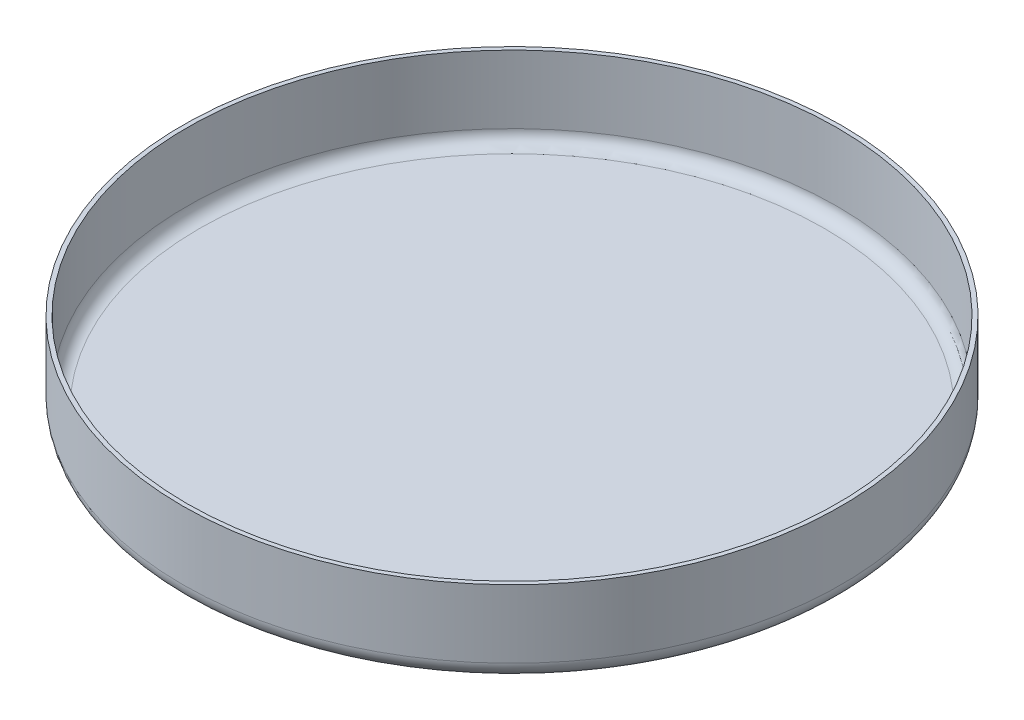
from build123d import *

# Parameters (mm, degrees)
SKETCH1_R          = 72.5
BASE_FLANGE1_DEPTH = 1


# Read off the part's stored shape, not the designer's step: Edge-Flange1
# Sheet-metal steps are written as plain solids
with BuildPart() as part:
    # Sketch1 → Base-Flange1 (new body)
    with BuildSketch(Plane(origin=(0, 0, 0), x_dir=(1, 0, 0), z_dir=(0, 1, 0))):
        with Locations(Location((0, 0, 0), (0, 0, 270))):
            Circle(SKETCH1_R)
    extrude(amount=-BASE_FLANGE1_DEPTH)

    # Edge-Flange1 outline → Edge-Flange1 (revolve)
    with BuildSketch(Plane.XY):
        with BuildLine():
            Line((77.5, 19), (76.5, 19))
            Line((76.5, 19), (76.5, 3))
            ThreePointArc((76.5, 3), (75.621320344, 0.878679656), (73.5, 0))
            Line((73.5, 0), (72.5, 0))
            Line((72.5, 0), (72.5, -1))
            Line((72.5, -1), (73.5, -1))
            ThreePointArc((73.5, -1), (76.328427125, 0.171572875), (77.5, 3))
            Line((77.5, 3), (77.5, 19))
        make_face()
    revolve(axis=Axis((0, 0, 0), (0, 1, 0)))


solid = part.part
